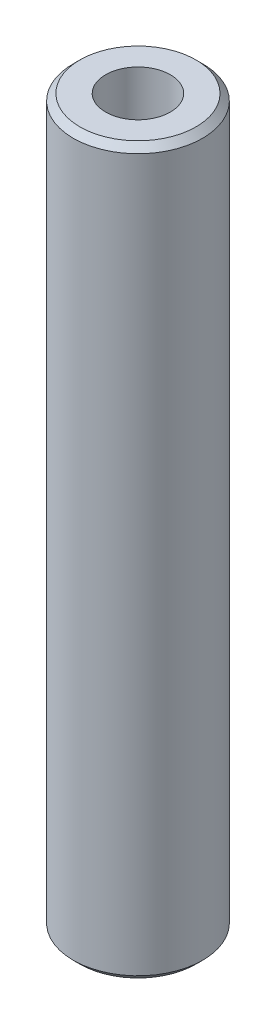
from build123d import *

# Parameters (mm, degrees)
SKETCH1_R           = 25
BOSS_EXTRUDE1_DEPTH = 280.450265498
SKETCH2_R           = 12.525332343
CUT_EXTRUDE1_DEPTH  = 283.67003983
CHAMFER1_SIZE       = 2.54579852


with BuildPart() as part:
    # Sketch1 → Boss-Extrude1 (new body)
    with BuildSketch(Plane(origin=(0, 0, 0), x_dir=(1, 0, 0), z_dir=(0, 1, 0))):
        Circle(SKETCH1_R)
    extrude(amount=BOSS_EXTRUDE1_DEPTH)

    # Sketch2 → Cut-Extrude1 (cut, through all)
    with BuildSketch(Plane(origin=(0, 0, 0), x_dir=(1, 0, 0), z_dir=(0, 1, 0))):
        Circle(SKETCH2_R)
    extrude(amount=CUT_EXTRUDE1_DEPTH, mode=Mode.SUBTRACT)

    # Chamfer1
    chamfer1_edges = [part.edges().sort_by_distance(p)[0] for p in [
        (-25, 280.450265498, 0),
        (-25, 0, 0),
    ]]
    chamfer(chamfer1_edges, length=CHAMFER1_SIZE)


solid = part.part
